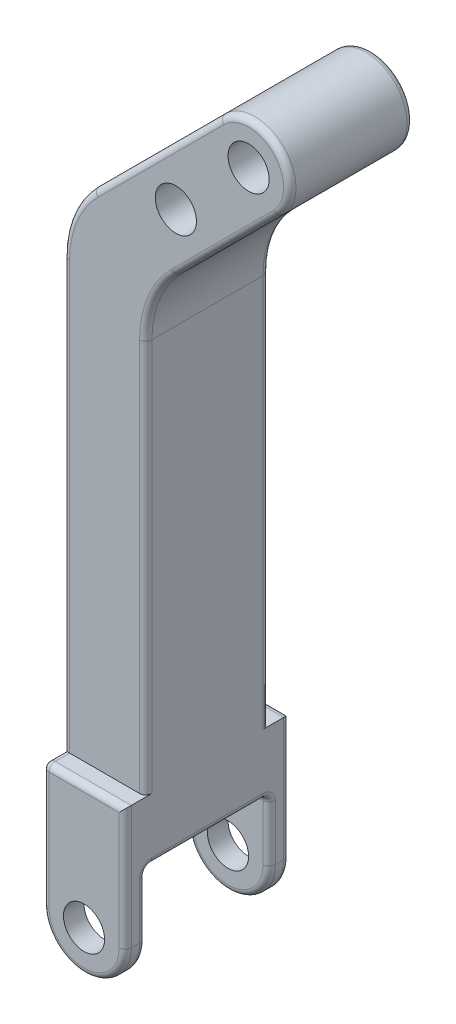
from build123d import *

# Parameters (mm, degrees)
SKETCH_1_R          = 20
SKETCH_1_R_2        = 10
EXTRUDE_1_DEPTH     = 60
EXTRUDE_2_DEPTH     = 30
SKETCH_4_R          = 10
EXTRUDE_3_DEPTH     = 10
SKETCH_8_R          = 10
CUT_EXTRUDE_1_DEPTH = 100
FILLET_1_R          = 50
FILLET_2_R          = 3


with BuildPart() as part:
    # 草图1 → 凸台-拉伸1 (new body)
    with BuildSketch(Plane.XY):
        Circle(SKETCH_1_R)
        Circle(SKETCH_1_R_2, mode=Mode.SUBTRACT)
    extrude(amount=EXTRUDE_1_DEPTH)

    # 草图2 → 凸台-拉伸2 (add, symmetric)
    with BuildSketch(Plane.XY.offset(30)):
        with BuildLine():
            Line((-14.142135624, 14.142135624), (-90, -61.715728753))
            Line((-90, -61.715728753), (-90, -320))
            Line((-90, -320), (-50, -320))
            Line((-50, -320), (-50, -78.284271247))
            Line((-50, -78.284271247), (14.142135624, -14.142135624))
            ThreePointArc((14.142135624, -14.142135624), (-14.142135624, -14.142135624), (-14.142135624, 14.142135624))
        make_face()
    extrude(amount=EXTRUDE_2_DEPTH, both=True)

    # 草图4 → 凸台-拉伸3 (add)
    with BuildSketch(Plane.XY.offset(60)):
        with BuildLine():
            Line((-90, -290), (-50, -290))
            Line((-50, -290), (-50, -350))
            ThreePointArc((-50, -350), (-70, -370), (-90, -350))
            Line((-90, -350), (-90, -290))
        make_face()
        with Locations((-70, -350)):
            Circle(SKETCH_4_R, mode=Mode.SUBTRACT)
    extrude_3 = extrude(amount=EXTRUDE_3_DEPTH)

    # 镜向1: 凸台-拉伸3 across plane
    add(extrude_3.mirror(Plane.XY.offset(30)))

    # 草图8 → 切除-拉伸1 (cut)
    with BuildSketch(Plane.XY.offset(60)):
        with Locations((-35.355339059, -35.355339059)):
            Circle(SKETCH_8_R)
    extrude(amount=-CUT_EXTRUDE_1_DEPTH, mode=Mode.SUBTRACT)

    # 圆角1
    fillet_1_edges = [part.edges().sort_by_distance(p)[0] for p in [
        (-90, -61.715728753, 30),
        (-50, -78.284271247, 30),
    ]]
    fillet(fillet_1_edges, radius=FILLET_1_R)

    # 圆角2
    fillet_2_edges = [part.edges().sort_by_distance(p)[0] for p in [
        (-50, -320, 70),
        (-70, -370, 70),
        (-50, -335, 60),
        (-70, -370, 60),
        (-50, -335, 0),
        (-70, -370, 0),
        (-50, -320, -10),
        (-70, -370, -10),
        (-70, -320, 60),
        (-50, -320, 30),
        (-70, -320, 0),
        (-90, -290, 65),
        (-90, -320, 70),
        (-90, -335, 60),
        (-90, -320, 30),
        (-90, -335, 0),
        (-90, -320, -10),
        (-90, -290, -5),
        (-50, -194.497474683, 0),
        (-46.193976626, -79.860777748, 0),
        (-10.606601718, -38.890872965, 0),
        (14.142135624, 14.142135624, 0),
        (-44.748737342, -16.464466094, 0),
        (-86.193976626, -63.292235253, 0),
        (-90, -186.213203436, 0),
        (14.142135624, 14.142135624, 60),
        (-10.606601718, -38.890872965, 60),
        (-46.193976626, -79.860777748, 60),
        (-50, -194.497474683, 60),
        (-90, -186.213203436, 60),
        (-86.193976626, -63.292235253, 60),
        (-44.748737342, -16.464466094, 60),
        (-70, -290, 70),
        (-70, -290, -10),
    ]]
    fillet(fillet_2_edges, radius=FILLET_2_R)


solid = part.part
